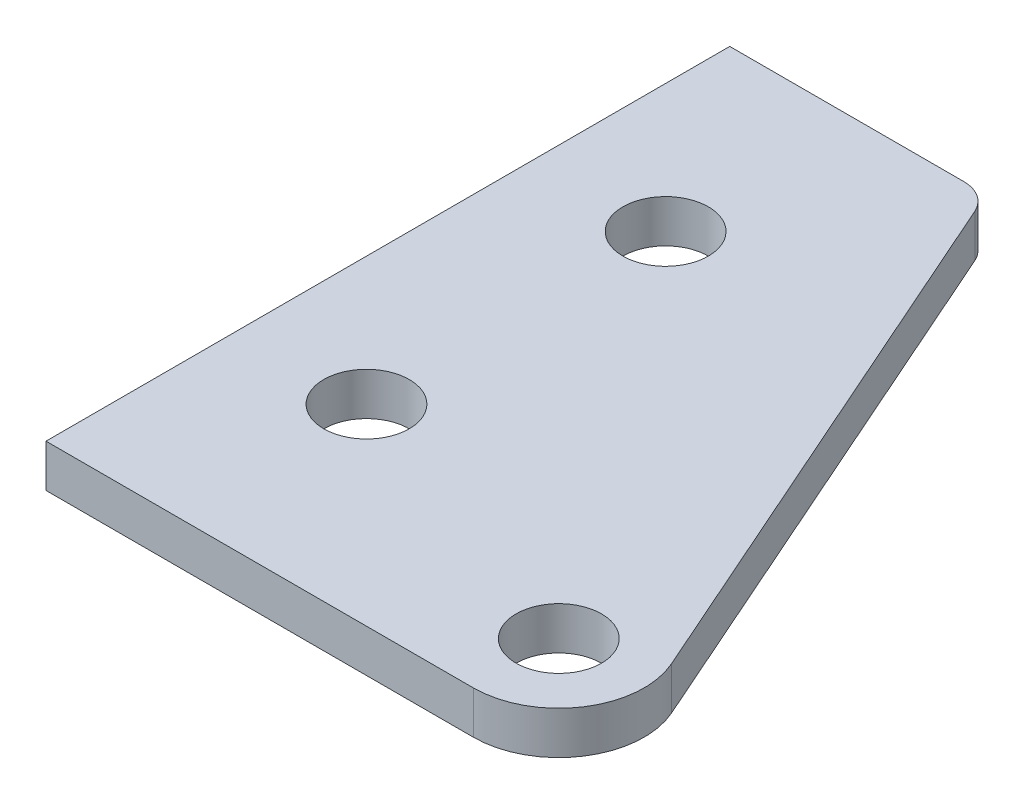
from build123d import *

# Parameters (mm, degrees)
BOSS_EXTRUDE1_DEPTH         = 3.175
F_1_4_0_25_DIAMETER_HOLE2_D = 6.35
F_1_4_0_25_DIAMETER_HOLE1_D = 6.35
FILLET1_R                   = 2.54


with BuildPart() as part:
    # Sketch1 → Boss-Extrude1 (new body)
    with BuildSketch(Plane(origin=(0, 0, 0), x_dir=(1, 0, 0), z_dir=(0, 1, 0))):
        with BuildLine():
            Line((0, 0), (0, 50.8))
            Line((0, 50.8), (19.05, 50.8))
            Line((19.05, 50.8), (37.558179404, 8.916622687))
            ThreePointArc((37.558179404, 8.916622687), (37.070740271, 2.8841346), (31.75, 0))
            Line((31.75, 0), (0, 0))
        make_face()
    extrude(amount=BOSS_EXTRUDE1_DEPTH)

    # 1/4 (0.25) Diameter Hole2 (through all)
    with Locations(Plane(origin=(0, 0, 0), x_dir=(-1, 0, 0), z_dir=(0, -1, 0))):
        with Locations((-31.75, 6.35)):
            Hole(F_1_4_0_25_DIAMETER_HOLE2_D / 2)

    # 1/4 (0.25) Diameter Hole1 (through all)
    with Locations(Plane(origin=(0, 3.175, 0), x_dir=(1, 0, 0), z_dir=(0, 1, 0))):
        with Locations((9.525, 36.5125), (9.525, 14.2875)):
            Hole(F_1_4_0_25_DIAMETER_HOLE1_D / 2)

    # Fillet1
    fillet1_edges = [part.edges().sort_by_distance(p)[0] for p in [
        (19.05, 1.5875, -50.8),
    ]]
    fillet(fillet1_edges, radius=FILLET1_R)


solid = part.part
